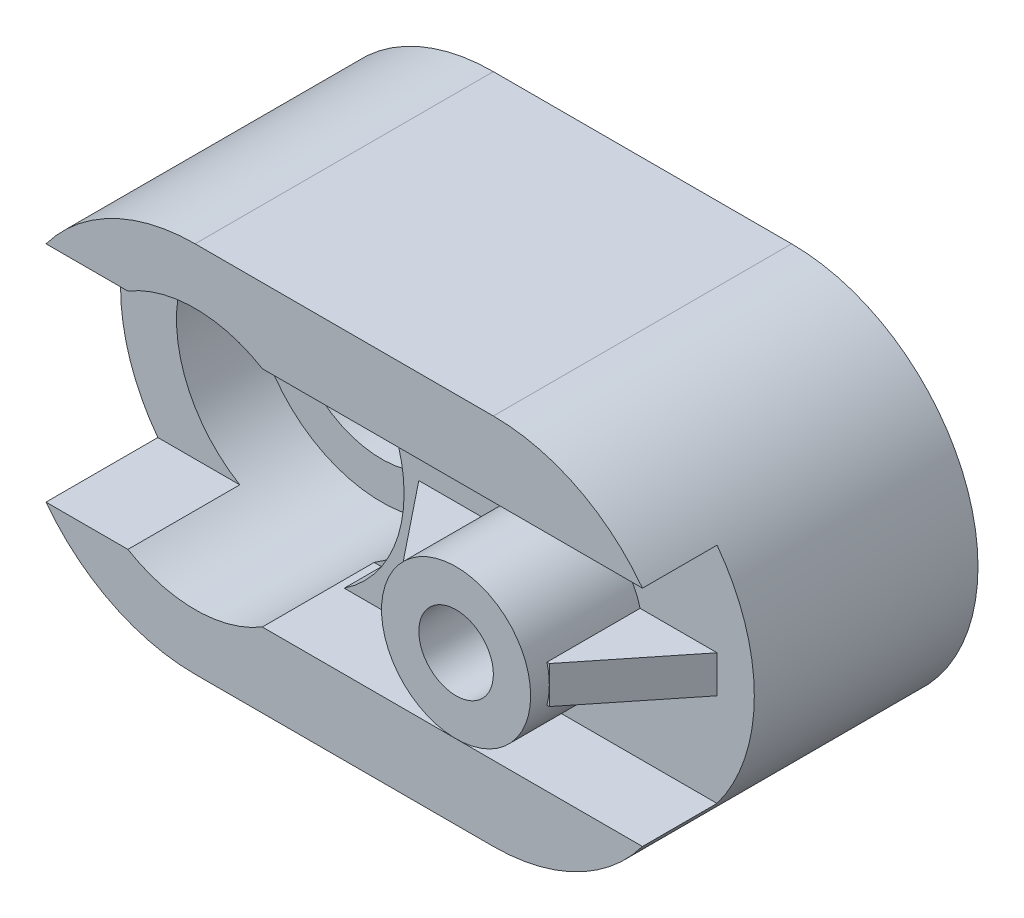
from build123d import *

# Parameters (mm, degrees)
BOSS_EXTRUDE1_DEPTH        = 80
SKETCH2_W                  = 20
SKETCH2_H                  = 10
CUT_EXTRUDE1_DEPTH         = 209
SKETCH3_R                  = 10
CUT_EXTRUDE2_DEPTH         = 40
BOSS_EXTRUDE2_START        = 10
SKETCH4_R                  = 20
SKETCH4_R_2                = 10
BOSS_EXTRUDE2_DEPTH        = 10
F_20_0MM_DOWEL_HOLE1_D     = 20
F_20_0MM_DOWEL_HOLE1_DEPTH = 50
F_20_0MM_DOWEL_HOLE1_TIP   = 6.00860619
CUT_EXTRUDE3_DEPTH         = 20
SKETCH10_R                 = 10
CUT_EXTRUDE4_DEPTH         = 74
SKETCH11_R                 = 25
SKETCH11_R_2               = 10
CUT_EXTRUDE5_DEPTH         = 40
SKETCH12_R                 = 25
CUT_EXTRUDE6_DEPTH         = 10
SKETCH14_R                 = 35
SKETCH14_R_2               = 25
CUT_EXTRUDE7_DEPTH         = 30
SKETCH15_R                 = 35
CUT_EXTRUDE8_DEPTH         = 30
CUT_EXTRUDE9_DEPTH         = 20
BOSS_EXTRUDE3_START        = 25
SKETCH17_W                 = 20
SKETCH17_H                 = 5
BOSS_EXTRUDE3_DEPTH        = 25
SKETCH18_W                 = 20
SKETCH18_H                 = 5
BOSS_EXTRUDE4_DEPTH        = 25
SKETCH19_W                 = 20
SKETCH19_H                 = 5
BOSS_EXTRUDE5_DEPTH        = 25
CHAMFER1_SIZE2             = 20
CHAMFER1_SIZE              = 25
CHAMFER3_SIZE2             = 25
CHAMFER3_SIZE              = 20


with BuildPart() as part:
    # Sketch1 → Boss-Extrude1 (new body)
    with BuildSketch(Plane.XY):
        with BuildLine():
            ThreePointArc((0, 50), (14.644660941, 14.644660941), (50, 0))
            Line((50, 0), (130, 0))
            ThreePointArc((130, 0), (165.355339059, 14.644660941), (180, 50))
            ThreePointArc((180, 50), (165.355339059, 85.355339059), (130, 100))
            Line((130, 100), (50, 100))
            ThreePointArc((50, 100), (14.644660941, 85.355339059), (0, 50))
        make_face()
    extrude(amount=BOSS_EXTRUDE1_DEPTH)

    # Sketch2 → Cut-Extrude1 (cut)
    with BuildSketch(Plane(origin=(0, 0, 0), x_dir=(0, 0, -1), z_dir=(1, 0, 0))):
        with Locations((-70, 75)):
            Rectangle(SKETCH2_W, SKETCH2_H)
        with Locations((-70, 25)):
            Rectangle(SKETCH2_W, SKETCH2_H)
    extrude(amount=CUT_EXTRUDE1_DEPTH, mode=Mode.SUBTRACT)

    # Sketch3 → Cut-Extrude2 (cut)
    with BuildSketch(Plane.XY.offset(80)):
        with Locations((130, 50)):
            Circle(SKETCH3_R)
    extrude(amount=-CUT_EXTRUDE2_DEPTH, mode=Mode.SUBTRACT)

    # Sketch4 → Boss-Extrude2 (add)
    with BuildSketch(Plane.XY.offset(80).offset(BOSS_EXTRUDE2_START)):
        with Locations(Location((130, 50, 0), (0, 0, 270))):
            Circle(SKETCH4_R)
        with Locations((130, 50)):
            Circle(SKETCH4_R_2, mode=Mode.SUBTRACT)
    extrude(amount=-BOSS_EXTRUDE2_DEPTH)

    # Ø20.0mm Dowel Hole1
    with Locations(Plane(origin=(130, 50, 90), x_dir=(1, 0, 0), z_dir=(0, 0, 1))):
        with Locations((0, 0)):
            Hole(F_20_0MM_DOWEL_HOLE1_D / 2, depth=F_20_0MM_DOWEL_HOLE1_DEPTH)
            with Locations((0, 0, -(F_20_0MM_DOWEL_HOLE1_DEPTH + F_20_0MM_DOWEL_HOLE1_TIP / 2))):  # 118° drill point
                Cone(0, F_20_0MM_DOWEL_HOLE1_D / 2, F_20_0MM_DOWEL_HOLE1_TIP, mode=Mode.SUBTRACT)

    # Sketch9 → Cut-Extrude3 (cut)
    with BuildSketch(Plane.XY.offset(80)):
        with BuildLine():
            Line((130, 70), (4.17424305, 70))
            ThreePointArc((4.17424305, 70), (0, 50), (4.17424305, 30))
            Line((4.17424305, 30), (130, 30))
            ThreePointArc((130, 30), (110, 50), (130, 70))
        make_face()
    extrude(amount=-CUT_EXTRUDE3_DEPTH, mode=Mode.SUBTRACT)

    # Sketch10 → Cut-Extrude4 (cut)
    with BuildSketch(Plane.XY.offset(60)):
        with Locations((50, 50)):
            Circle(SKETCH10_R)
    extrude(amount=-CUT_EXTRUDE4_DEPTH, mode=Mode.SUBTRACT)

    # Sketch11 → Cut-Extrude5 (cut)
    with BuildSketch(Plane.XY.offset(60)):
        with Locations((50, 50)):
            Circle(SKETCH11_R)
        with Locations((50, 50)):
            Circle(SKETCH11_R_2, mode=Mode.SUBTRACT)
    extrude(amount=-CUT_EXTRUDE5_DEPTH, mode=Mode.SUBTRACT)

    # Sketch12 → Cut-Extrude6 (cut)
    with BuildSketch(Plane.XY.offset(60)):
        with BuildLine():
            Line((70, 80), (10, 80))
            ThreePointArc((10, 80), (0, 50), (10, 20))
            Line((10, 20), (70, 20))
            ThreePointArc((70, 20), (86.055512755, 50), (70, 80))
        make_face()
        with Locations((50, 50)):
            Circle(SKETCH12_R, mode=Mode.SUBTRACT)
    extrude(amount=-CUT_EXTRUDE6_DEPTH, mode=Mode.SUBTRACT)

    # Sketch14 → Cut-Extrude7 (cut)
    with BuildSketch(Plane.XY.offset(60)):
        with Locations((50, 50)):
            Circle(SKETCH14_R)
        with Locations((50, 50)):
            Circle(SKETCH14_R_2, mode=Mode.SUBTRACT)
    extrude(amount=-CUT_EXTRUDE7_DEPTH, mode=Mode.SUBTRACT)

    # Sketch15 → Cut-Extrude8 (cut)
    with BuildSketch(Plane.XY.offset(80)):
        with Locations((50, 50)):
            Circle(SKETCH15_R)
    extrude(amount=-CUT_EXTRUDE8_DEPTH, mode=Mode.SUBTRACT)

    # Sketch16 → Cut-Extrude9 (cut)
    with BuildSketch(Plane.XY.offset(80)):
        with BuildLine():
            Line((130, 70), (175.82575695, 70))
            ThreePointArc((175.82575695, 70), (180, 50), (175.82575695, 30))
            Line((175.82575695, 30), (130, 30))
            ThreePointArc((130, 30), (150, 50), (130, 70))
        make_face()
    extrude(amount=-CUT_EXTRUDE9_DEPTH, mode=Mode.SUBTRACT)

    # Sketch17 → Boss-Extrude3 (add)
    with BuildSketch(Plane.XY.offset(60).offset(BOSS_EXTRUDE3_START)):
        with BuildLine():
            Line((150, 45), (150, 50))
            ThreePointArc((150, 50), (149.840593925, 47.47991415), (149.364916731, 45))
            Line((149.364916731, 45), (150, 45))
        make_face()
        with Locations((160, 47.5)):
            Rectangle(SKETCH17_W, SKETCH17_H)
        with BuildLine():
            ThreePointArc((110.635083269, 45), (110.159406075, 47.47991415), (110, 50))
            Line((110, 50), (110, 45))
            Line((110, 45), (110.635083269, 45))
        make_face()
        with Locations((100, 47.5)):
            Rectangle(SKETCH17_W, SKETCH17_H)
    extrude(amount=-BOSS_EXTRUDE3_DEPTH)

    # Sketch18 → Boss-Extrude4 (add)
    with BuildSketch(Plane.XY.offset(85)):
        with BuildLine():
            ThreePointArc((110.635083269, 55), (110.159406075, 52.52008585), (110, 50))
            Line((110, 50), (110, 55))
            Line((110, 55), (110.635083269, 55))
        make_face()
        with Locations((100, 52.5)):
            Rectangle(SKETCH18_W, SKETCH18_H)
    extrude(amount=-BOSS_EXTRUDE4_DEPTH)

    # Sketch19 → Boss-Extrude5 (add)
    with BuildSketch(Plane.XY.offset(85)):
        with BuildLine():
            Line((150, 55), (149.364916731, 55))
            ThreePointArc((149.364916731, 55), (149.840593925, 52.52008585), (150, 50))
            Line((150, 50), (150, 55))
        make_face()
        with Locations((160, 52.5)):
            Rectangle(SKETCH19_W, SKETCH19_H)
    extrude(amount=-BOSS_EXTRUDE5_DEPTH)

    # Chamfer1
    chamfer1_edges = [part.edges().sort_by_distance(p)[0] for p in [
        (90, 52.5, 85),
    ]]
    chamfer1_side = [part.faces().sort_by_distance(p)[0] for p in [
        (90, 52.5, 84.6),
    ]]
    chamfer(chamfer1_edges, length=CHAMFER1_SIZE - 0.0001, length2=CHAMFER1_SIZE2 - 0.0001, reference=chamfer1_side[0])  # a hair under: the kernel refuses the full size

    # Chamfer3
    chamfer3_edges = [part.edges().sort_by_distance(p)[0] for p in [
        (170, 52.5, 85),
    ]]
    chamfer3_side = [part.faces().sort_by_distance(p)[0] for p in [
        (169.6, 52.5, 85),
    ]]
    chamfer(chamfer3_edges, length=CHAMFER3_SIZE - 0.0001, length2=CHAMFER3_SIZE2 - 0.0001, reference=chamfer3_side[0])  # a hair under: the kernel refuses the full size


solid = part.part
